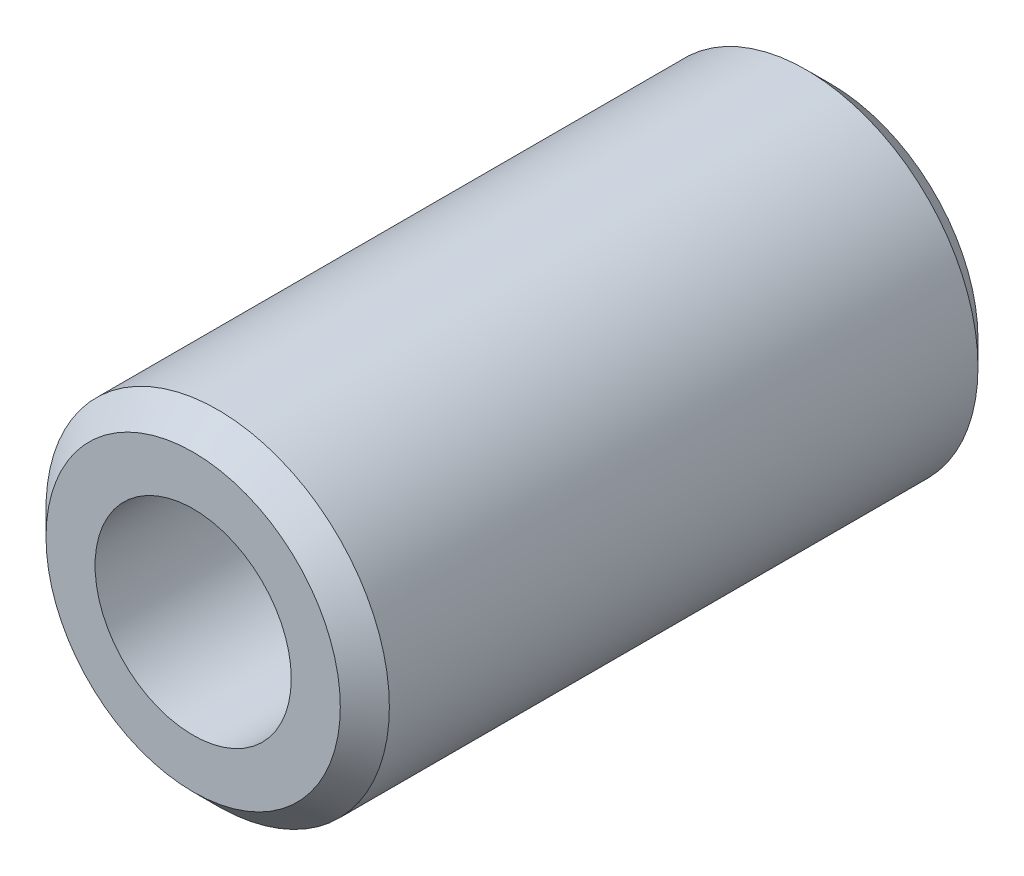
from build123d import *

# Parameters (mm, degrees)
SKETCH1_R               = 17.5
BOSS_EXTRUDE1_DEPTH     = 65
CUT_EXTRUDE1_DEPTH      = 70.552138716
CUT_EXTRUDE1_DEPTH_BACK = 70.552138716
SKETCH2_R               = 10
CHAMFER1_SIZE           = 2.5


with BuildPart() as part:
    # Sketch1 → Boss-Extrude1 (new body)
    with BuildSketch(Plane.XY):
        Circle(SKETCH1_R)
    extrude(amount=BOSS_EXTRUDE1_DEPTH)

    # Sketch2 → Cut-Extrude1 (cut, two sides: drawn at the far end of the back side and taken through both)
    with BuildSketch(Plane.XY.offset(65).offset(-CUT_EXTRUDE1_DEPTH_BACK)):
        Circle(SKETCH2_R)
    extrude(amount=CUT_EXTRUDE1_DEPTH + CUT_EXTRUDE1_DEPTH_BACK, mode=Mode.SUBTRACT)

    # Chamfer1
    chamfer1_edges = [part.edges().sort_by_distance(p)[0] for p in [
        (-17.5, 0, 65),
        (-17.5, 0, 0),
    ]]
    chamfer(chamfer1_edges, length=CHAMFER1_SIZE)


solid = part.part
